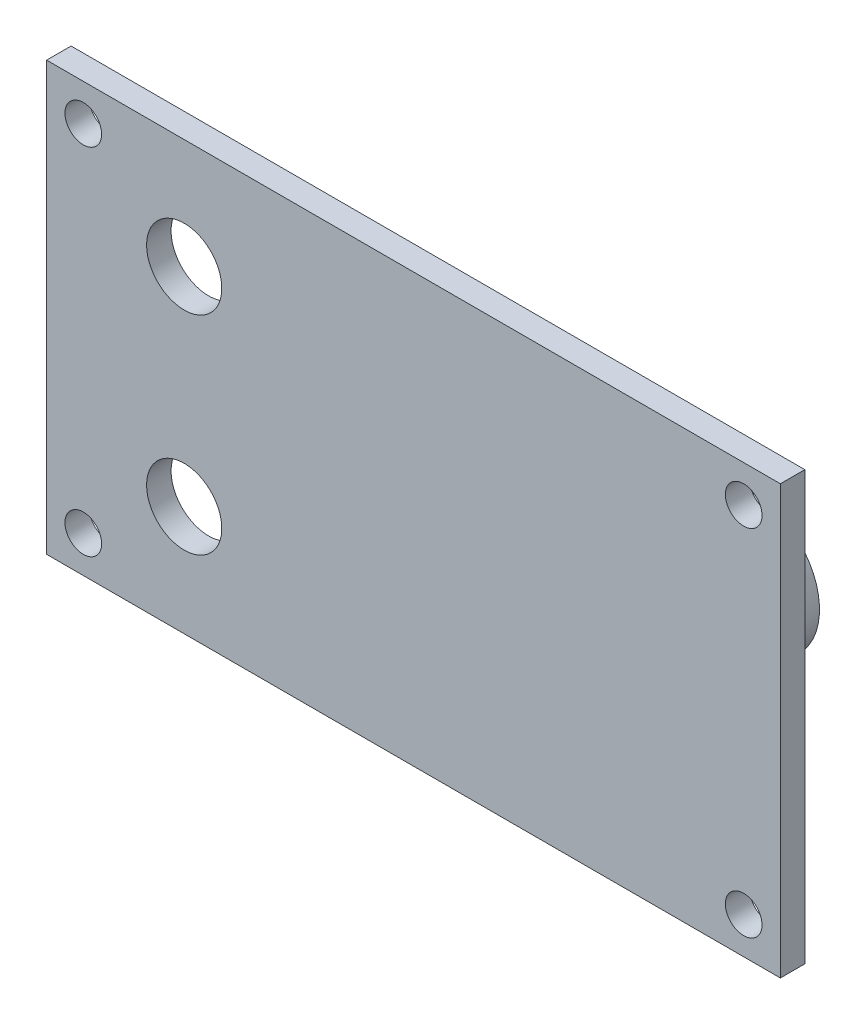
from build123d import *

# Parameters (mm, degrees)
SKETCH1_W           = 60
SKETCH1_H           = 35
SKETCH1_R           = 1.5
BOSS_EXTRUDE1_DEPTH = 2
SKETCH2_R           = 5.5
BOSS_EXTRUDE2_DEPTH = 8.2
SKETCH5_R           = 3
CUT_EXTRUDE2_DEPTH  = 8.2
SKETCH6_R           = 3.075
CUT_EXTRUDE3_DEPTH  = 8.2
FILLET4_R           = 1


with BuildPart() as part:
    # Sketch1 → Boss-Extrude1 (new body)
    with BuildSketch(Plane.XY):
        with Locations((30, 17.5)):
            Rectangle(SKETCH1_W, SKETCH1_H)
        with Locations((57, 32)):
            Circle(SKETCH1_R, mode=Mode.SUBTRACT)
        with Locations((57, 3)):
            Circle(SKETCH1_R, mode=Mode.SUBTRACT)
        with Locations((3, 3)):
            Circle(SKETCH1_R, mode=Mode.SUBTRACT)
        with Locations((3, 32)):
            Circle(SKETCH1_R, mode=Mode.SUBTRACT)
    extrude(amount=BOSS_EXTRUDE1_DEPTH)

    # Sketch2 → Boss-Extrude2 (add)
    with BuildSketch(Plane(origin=(0, 0, 0), x_dir=(-1, 0, 0), z_dir=(0, 0, -1))):
        with Locations((-36.25, 15.5)):
            Circle(SKETCH2_R)
        with Locations((-25, 17.5)):
            Circle(SKETCH2_R)
        with Locations((-47.5, 17.5)):
            Circle(SKETCH2_R)
    extrude(amount=BOSS_EXTRUDE2_DEPTH)

    # Sketch5 → Cut-Extrude2 (cut)
    with BuildSketch(Plane(origin=(0, 0, -8.2), x_dir=(-1, 0, 0), z_dir=(0, 0, -1))):
        with Locations((-47.5, 17.5)):
            Circle(SKETCH5_R)
        with Locations((-36.25, 15.5)):
            Circle(SKETCH5_R)
        with Locations((-25, 17.5)):
            Circle(SKETCH5_R)
    extrude(amount=-CUT_EXTRUDE2_DEPTH, mode=Mode.SUBTRACT)

    # Sketch6 → Cut-Extrude3 (cut)
    with BuildSketch(Plane(origin=(0, 0, 0), x_dir=(-1, 0, 0), z_dir=(0, 0, -1))):
        with Locations((-11.25, 26)):
            Circle(SKETCH6_R)
        with Locations((-11.25, 9)):
            Circle(SKETCH6_R)
    extrude(amount=-CUT_EXTRUDE3_DEPTH, mode=Mode.SUBTRACT)

    # Fillet4
    # the kernel refuses this fillet: 1 mm, written as the material it adds along each edge
    with BuildSketch(Plane(origin=(36.25, 15.5, 0), x_dir=(-1, 0, 0), z_dir=(0, -1, 0))) as fillet4_piece_1:
        with BuildLine():
            CenterArc((5.5 + FILLET4_R, FILLET4_R), FILLET4_R, 180, 90)
            Line((5.5, FILLET4_R), (5.5, 0))
            Line((5.5, 0), (5.5 + FILLET4_R, 0))
        make_face()
    revolve(axis=Axis((36.25, 15.5, 0), (0, 0, -1)))
    with BuildSketch(Plane(origin=(25, 17.5, 0), x_dir=(-1, 0, 0), z_dir=(0, -1, 0))) as fillet4_piece_2:
        with BuildLine():
            CenterArc((5.5 + FILLET4_R, FILLET4_R), FILLET4_R, 180, 90)
            Line((5.5, FILLET4_R), (5.5, 0))
            Line((5.5, 0), (5.5 + FILLET4_R, 0))
        make_face()
    revolve(axis=Axis((25, 17.5, 0), (0, 0, -1)))
    with BuildSketch(Plane(origin=(47.5, 17.5, 0), x_dir=(-1, 0, 0), z_dir=(0, -1, 0))) as fillet4_piece_3:
        with BuildLine():
            CenterArc((5.5 + FILLET4_R, FILLET4_R), FILLET4_R, 180, 90)
            Line((5.5, FILLET4_R), (5.5, 0))
            Line((5.5, 0), (5.5 + FILLET4_R, 0))
        make_face()
    revolve(axis=Axis((47.5, 17.5, 0), (0, 0, -1)))


solid = part.part
